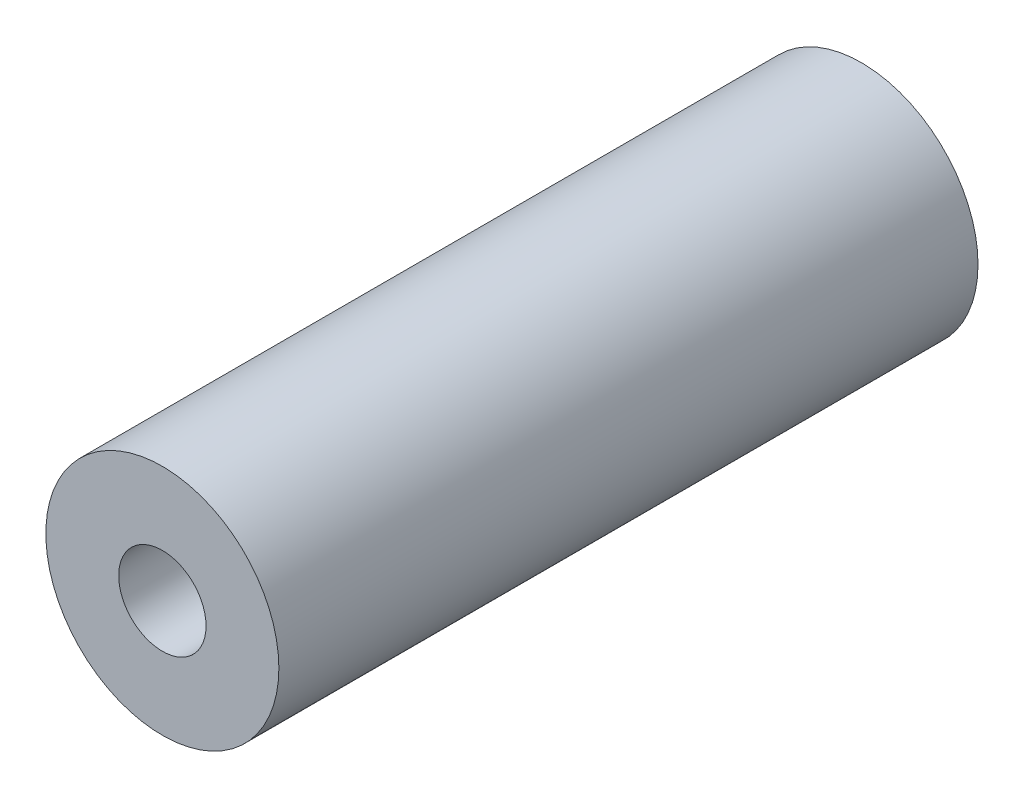
from build123d import *

# Parameters (mm, degrees)
SKETCH2_R           = 2
SKETCH2_R_2         = 0.75
BOSS_EXTRUDE1_DEPTH = 12


with BuildPart() as part:
    # Sketch2 → Boss-Extrude1 (new body)
    with BuildSketch(Plane.XY):
        Circle(SKETCH2_R)
        Circle(SKETCH2_R_2, mode=Mode.SUBTRACT)
    extrude(amount=BOSS_EXTRUDE1_DEPTH)


solid = part.part
